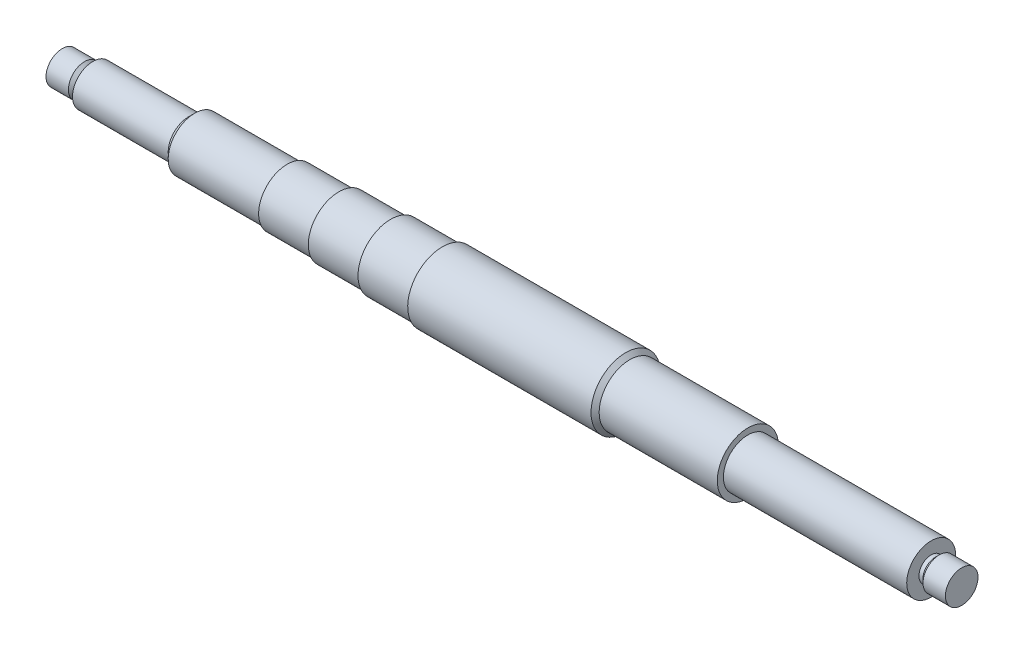
from build123d import *


with BuildPart() as part:
    # Sketch1 → Revolve1 (revolve)
    with BuildSketch(Plane.XY):
        Polygon((0, 0), (0, 4), (5.5, 4), (6.5, 3), (7.5, 3), (7.5, 5), (31, 5), (32.5, 6.5), (42.5, 6.5), (55.2, 6.5), (55.2, 7), (67.9, 7), (67.9, 7.5), (80.6, 7.5), (80.6, 8), (93.3, 8), (93.3, 8.5), (138.3, 8.5), (139.3, 7.5), (168.3, 7.5), (168.3, 6), (213.3, 6), (213.3, 3), (214.3, 3), (215.303970343, 4.003970343), (220.8, 4.003970343), (220.8, 0), align=None)
    revolve(axis=Axis((0, 0, 0), (1, 0, 0)))


solid = part.part
